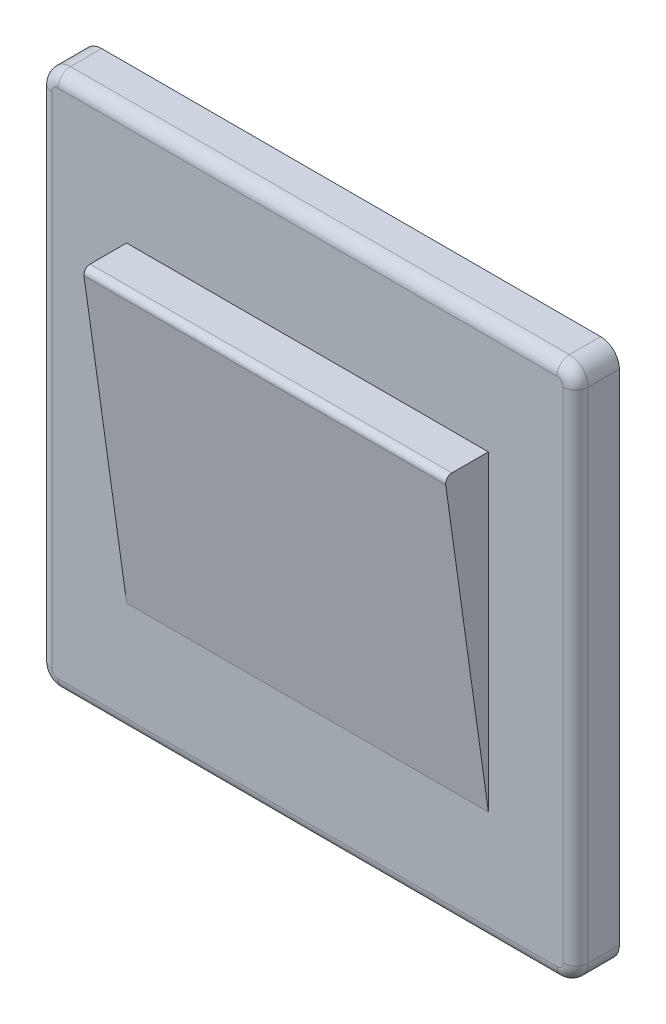
from build123d import *

# Parameters (mm, degrees)
SKETCH_1_W          = 86
SKETCH_1_H          = 86
SKETCH_1_W_2        = 58
SKETCH_1_H_2        = 50
EXTRUDE_1_DEPTH     = 7
SKETCH_1_5_W        = 58
SKETCH_1_5_H        = 50
EXTRUDE_3_DEPTH     = 14
CUT_EXTRUDE_1_DEPTH = 114.030969208
FILLET_1_R          = 3
FILLET_2_R          = 1
FILLET_3_R          = 2


with BuildPart() as part:
    # 草图1 → 凸台-拉伸1 (new body)
    # profile 1 of 2: a face of its own
    with BuildSketch(Plane.XY):
        with Locations((43, 43)):
            Rectangle(SKETCH_1_W, SKETCH_1_H)
        with Locations((43, 43)):
            Rectangle(SKETCH_1_W_2, SKETCH_1_H_2, mode=Mode.SUBTRACT)
    # profile 2 of 2: a face of its own
    with BuildSketch(Plane.XY):
        with Locations((43, 43)):
            Rectangle(SKETCH_1_W_2, SKETCH_1_H_2)
    extrude(amount=EXTRUDE_1_DEPTH)

    # 草图1<5> → 凸台-拉伸3 (add)
    with BuildSketch(Plane.XY):
        with Locations((43, 43)):
            Rectangle(SKETCH_1_5_W, SKETCH_1_5_H)
    extrude(amount=EXTRUDE_3_DEPTH)

    # 草图2 → 切除-拉伸1 (cut, through all)
    with BuildSketch(Plane.ZY.offset(-14)):
        Polygon((14, 68), (7, 18), (14, 18), align=None)
    extrude(amount=-CUT_EXTRUDE_1_DEPTH, mode=Mode.SUBTRACT)

    # 圆角1
    fillet_1_edges = [part.edges().sort_by_distance(p)[0] for p in [
        (0, 0, 3.5),
        (0, 86, 3.5),
        (86, 86, 3.5),
        (86, 0, 3.5),
    ]]
    fillet(fillet_1_edges, radius=FILLET_1_R)

    # 圆角2
    fillet_2_edges = [part.edges().sort_by_distance(p)[0] for p in [
        (43, 68, 14),
    ]]
    fillet(fillet_2_edges, radius=FILLET_2_R)

    # 圆角3
    # the kernel refuses this fillet: 2 mm, written as the material it takes off along each edge
    with BuildSketch(Plane(origin=(83, 86, 7), x_dir=(0, -1, 0), z_dir=(-1, 0, 0)), Plane(origin=(3, 0, 7), x_dir=(0, 1, 0), z_dir=(1, 0, 0)), Plane(origin=(0, 83, 7), x_dir=(1, 0, 0), z_dir=(0, -1, 0))) as fillet_3_piece_1:
        with BuildLine():
            CenterArc((FILLET_3_R, -FILLET_3_R), FILLET_3_R, 90, 90)
            Line((0, -FILLET_3_R), (0, 0))
            Line((0, 0), (FILLET_3_R, 0))
        make_face()
    extrude(amount=80, mode=Mode.SUBTRACT)
    with BuildSketch(Plane(origin=(86, 18, 7), x_dir=(-1, 0, 0), z_dir=(0, 1, 0))) as fillet_3_piece_2:
        with BuildLine():
            CenterArc((FILLET_3_R, -FILLET_3_R), FILLET_3_R, 90, 90)
            Line((0, -FILLET_3_R), (0, 0))
            Line((0, 0), (FILLET_3_R, 0))
        make_face()
    extrude(amount=65, mode=Mode.SUBTRACT)
    with BuildSketch(Plane(origin=(3, 83, 7), x_dir=(-1, 0, 0), z_dir=(0, -1, 0))) as fillet_3_piece_3:
        with BuildLine():
            CenterArc((3 - FILLET_3_R, FILLET_3_R), FILLET_3_R, 270, 90)
            Line((3, FILLET_3_R), (3, 0))
            Line((3, 0), (3 - FILLET_3_R, 0))
        make_face()
    revolve(axis=Axis((3, 83, 7), (0, 0, -1)), revolution_arc=90, mode=Mode.SUBTRACT)
    with BuildSketch(Plane(origin=(3, 3, 7), x_dir=(0, -1, 0), z_dir=(1, 0, 0))) as fillet_3_piece_4:
        with BuildLine():
            CenterArc((3 - FILLET_3_R, FILLET_3_R), FILLET_3_R, 270, 90)
            Line((3, FILLET_3_R), (3, 0))
            Line((3, 0), (3 - FILLET_3_R, 0))
        make_face()
    revolve(axis=Axis((3, 3, 7), (0, 0, -1)), revolution_arc=90, mode=Mode.SUBTRACT)
    with BuildSketch(Plane(origin=(83, 3, 7), x_dir=(0, -1, 0), z_dir=(-1, 0, 0))) as fillet_3_piece_5:
        with BuildLine():
            CenterArc((3 - FILLET_3_R, -FILLET_3_R), FILLET_3_R, 0, 90)
            Line((3, -FILLET_3_R), (3, 0))
            Line((3, 0), (3 - FILLET_3_R, 0))
        make_face()
    revolve(axis=Axis((83, 3, 7), (0, 0, 1)), revolution_arc=90, mode=Mode.SUBTRACT)
    with BuildSketch(Plane(origin=(83, 83, 7), x_dir=(1, 0, 0), z_dir=(0, -1, 0))) as fillet_3_piece_6:
        with BuildLine():
            CenterArc((3 - FILLET_3_R, -FILLET_3_R), FILLET_3_R, 0, 90)
            Line((3, -FILLET_3_R), (3, 0))
            Line((3, 0), (3 - FILLET_3_R, 0))
        make_face()
    revolve(axis=Axis((83, 83, 7), (0, 0, 1)), revolution_arc=90, mode=Mode.SUBTRACT)
    with BuildSketch(Plane(origin=(86, 3, 7), x_dir=(-1, 0, 0), z_dir=(0, 1, 0))) as fillet_3_piece_7:
        with BuildLine():
            CenterArc((FILLET_3_R, -FILLET_3_R), FILLET_3_R, 90, 90)
            Line((0, -FILLET_3_R), (0, 0))
            Line((0, 0), (FILLET_3_R, 0))
        make_face()
    extrude(amount=15, mode=Mode.SUBTRACT)


solid = part.part
